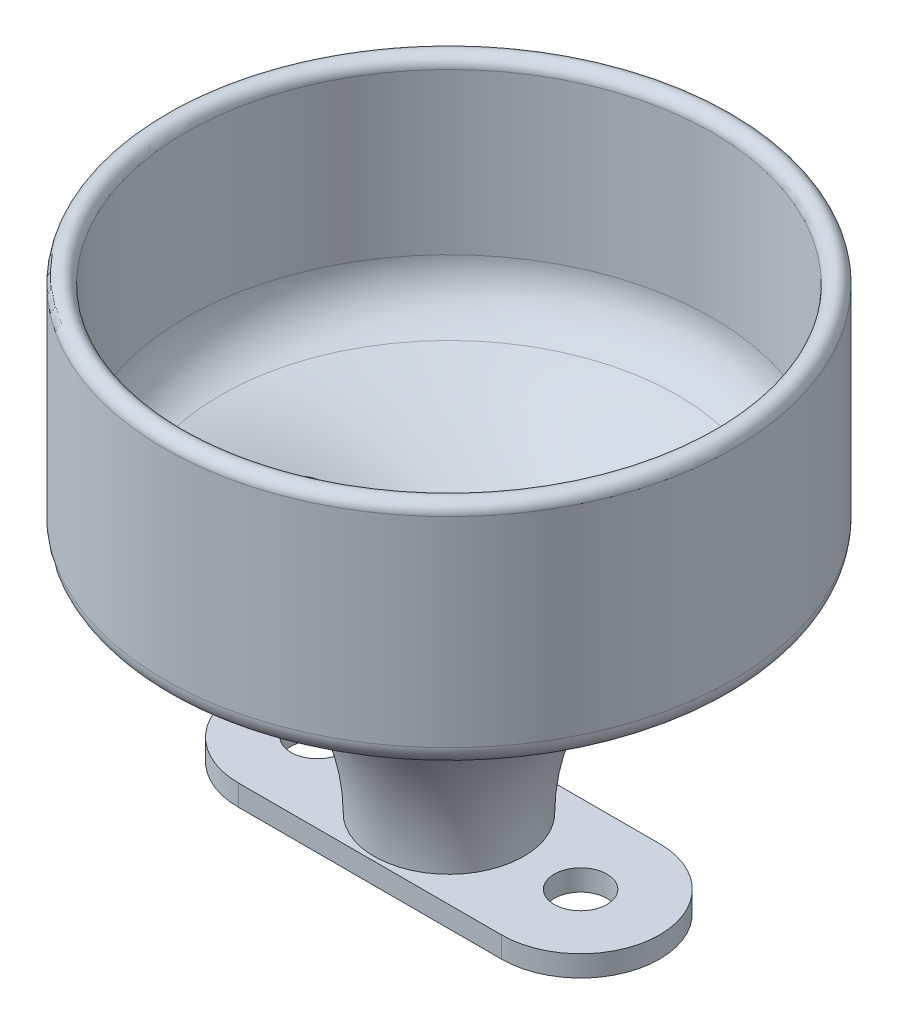
from build123d import *

# Parameters (mm, degrees)
FILLET1_R               = 0.635
FILLET2_R               = 3.175
CUT_EXTRUDE1_DEPTH      = 39.194381605
CUT_EXTRUDE1_DEPTH_BACK = 39.194381605
SKETCH2_R               = 1.5875
SKETCH3_OUTSIDE_W       = 47.644
SKETCH3_OUTSIDE_H       = 47.644
CUT_EXTRUDE2_DEPTH      = 2.54


with BuildPart() as part:
    # Sketch1 → Revolve1 (revolve)
    with BuildSketch(Plane.XY, mode=Mode.PRIVATE) as revolve1_sk:
        with BuildLine():
            Line((-3.2385, 0), (-12.7, 0))
            Line((-12.7, 0), (-12.7, 1.27))
            Line((-12.7, 1.27), (-4.5085, 1.27))
            ThreePointArc((-4.5085, 1.27), (-7.781676358, 10.483891575), (-16.13408, 15.567869823))
            ThreePointArc((-16.13408, 15.567869823), (-16.860375969, 16.009954888), (-17.145, 16.811162851))
            Line((-17.145, 16.811162851), (-17.145, 29.511162851))
            Line((-17.145, 29.511162851), (-15.875, 29.511162851))
            Line((-15.875, 29.511162851), (-15.875, 16.811162851))
            ThreePointArc((-15.875, 16.811162851), (-6.796300389, 11.285099538), (-3.2385, 1.27))
            Line((-3.2385, 1.27), (-3.2385, 0))
        make_face()
    revolve(revolve1_sk.sketch.rotate(Axis((0, 0, 0), (0, 1, 0)), 270), axis=Axis((0, 0, 0), (0, 1, 0)))

    # Fillet1
    fillet1_edges = [part.edges().sort_by_distance(p)[0] for p in [
        (0, 29.511162851, 17.145),
        (0, 29.511162851, 15.875),
    ]]
    fillet(fillet1_edges, radius=FILLET1_R - 0.0001)  # a hair under: the kernel refuses the full size

    # Fillet2
    fillet2_edges = [part.edges().sort_by_distance(p)[0] for p in [
        (0, 16.811162851, 15.875),
    ]]
    fillet(fillet2_edges, radius=FILLET2_R)

    # Sketch2 → Cut-Extrude1 (cut, two sides: drawn at the far end of the back side and taken through both)
    with BuildSketch(Plane.XZ.offset(-CUT_EXTRUDE1_DEPTH_BACK)):
        with Locations(Location((-7.9375, 0, 0), (0, 0, 270))):
            Circle(SKETCH2_R)
        with Locations(Location((7.9375, 0, 0), (0, 0, 270))):
            Circle(SKETCH2_R)
    extrude(amount=CUT_EXTRUDE1_DEPTH + CUT_EXTRUDE1_DEPTH_BACK, mode=Mode.SUBTRACT)

    # Sketch3 outside → Cut-Extrude2 (cut)
    with BuildSketch(Plane(origin=(0, 0, 0), x_dir=(-1, 0, 0), z_dir=(0, -1, 0))):
        Rectangle(SKETCH3_OUTSIDE_W, SKETCH3_OUTSIDE_H)
        with BuildLine():
            Line((7.9375, -4.7625), (-7.9375, -4.7625))
            ThreePointArc((-7.9375, -4.7625), (-12.7, 0), (-7.9375, 4.7625))
            Line((-7.9375, 4.7625), (7.9375, 4.7625))
            ThreePointArc((7.9375, 4.7625), (12.7, 0), (7.9375, -4.7625))
        make_face(mode=Mode.SUBTRACT)
    extrude(amount=-CUT_EXTRUDE2_DEPTH, mode=Mode.SUBTRACT)


solid = part.part
